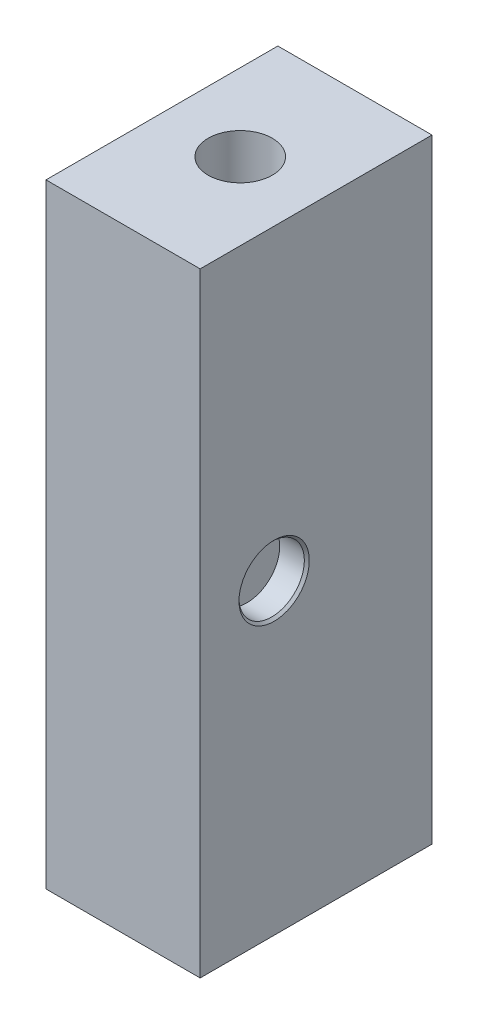
from build123d import *

# Parameters (mm, degrees)
SKETCH1_W           = 12.5
SKETCH1_H           = 18.8
SKETCH1_R           = 2.6
BOSS_EXTRUDE1_DEPTH = 24.9
SKETCH2_R           = 2.65
CUT_EXTRUDE1_DEPTH  = 2.2
CHAMFER1_SIZE       = 0.2


with BuildPart() as part:
    # Sketch1 → Boss-Extrude1 (new, symmetric)
    with BuildSketch(Plane(origin=(0, 0, 0), x_dir=(1, 0, 0), z_dir=(0, 1, 0))):
        with Locations((0, -0.1)):
            Rectangle(SKETCH1_W, SKETCH1_H)
        Circle(SKETCH1_R, mode=Mode.SUBTRACT)
    extrude(amount=BOSS_EXTRUDE1_DEPTH, both=True)

    # Sketch2 → Cut-Extrude1 (cut)
    with BuildSketch(Plane(origin=(6.25, 0, 0), x_dir=(0, 0, -1), z_dir=(1, 0, 0))):
        with Locations((-3.5, 0)):
            Circle(SKETCH2_R)
    extrude(amount=-CUT_EXTRUDE1_DEPTH, mode=Mode.SUBTRACT)

    # Chamfer1
    chamfer1_edges = [part.edges().sort_by_distance(p)[0] for p in [
        (6.25, 0, 6.15),
    ]]
    chamfer(chamfer1_edges, length=CHAMFER1_SIZE)


solid = part.part
